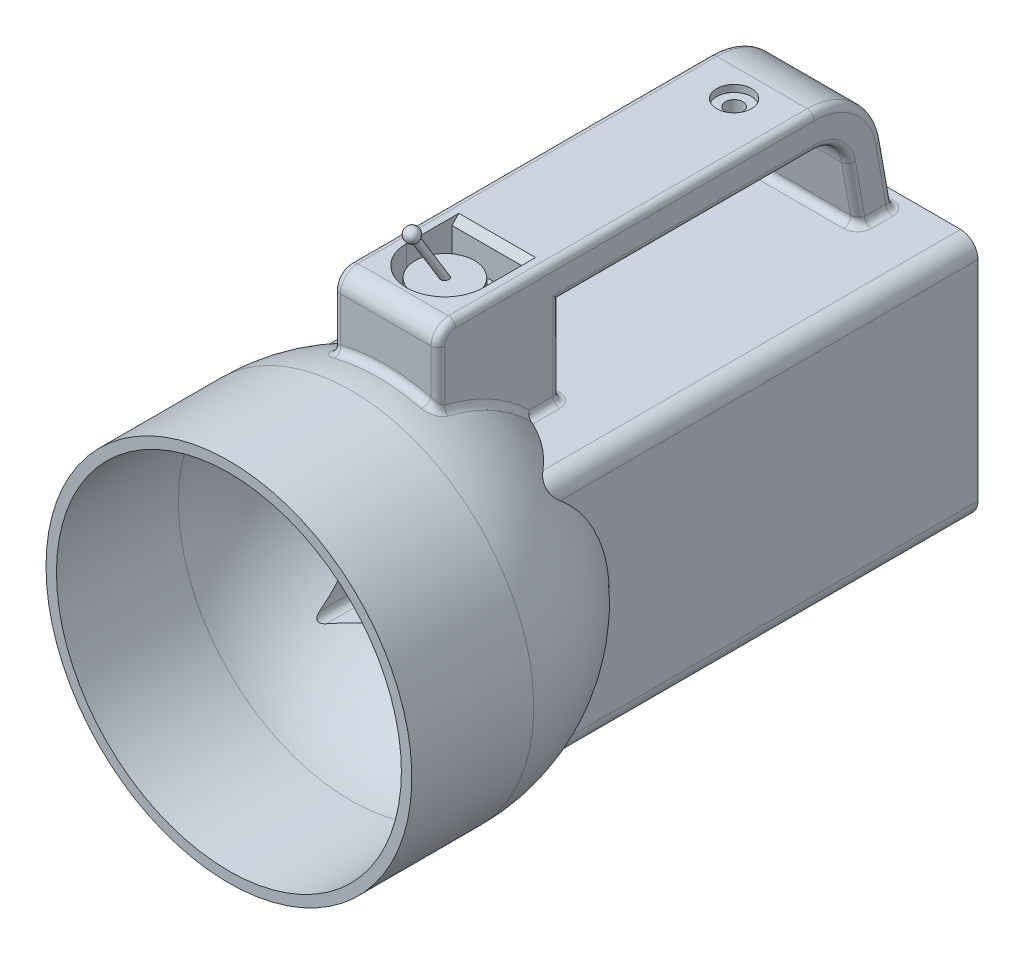
from build123d import *

# Parameters (mm, degrees)
SKETCH1_W                               = 70
SKETCH1_H                               = 70
BOSS_EXTRUDE2_DEPTH                     = 180
FILLET1_R                               = 5
SHELL1_START                            = 3
SHELL1_DEPTH                            = 177
SHELL1_START_2                          = 144.9999999
SHELL1_2_OUTLINE_R                      = 49.5
SHELL1_2_DEPTH                          = 35.0000001
BOSS_EXTRUDE3_DEPTH                     = 15
BOSS_EXTRUDE4_REACH                     = 220.661
SKETCH7_W                               = 30
SKETCH7_H                               = 35
CBORE_FOR_M5_HEX_HEAD_BOLT1_D           = 5
CBORE_FOR_M5_HEX_HEAD_BOLT1_DEPTH       = 10
CBORE_FOR_M5_HEX_HEAD_BOLT1_CBORE_D     = 10
CBORE_FOR_M5_HEX_HEAD_BOLT1_CBORE_DEPTH = 2
CUT_EXTRUDE1_DEPTH                      = 10
SKETCH14_R                              = 8.5
BOSS_EXTRUDE5_DEPTH                     = 7
FILLET2_R                               = 5
FILLET3_R                               = 2
CHAMFER1_SIZE                           = 2
RIB6_REACH                              = 190.577
SKETCH22_WALLS_W                        = 443.153814776
SKETCH22_WALLS_H                        = 3
RIB6_DRAFT_ANGLE                        = 10


with BuildPart() as part:
    # Sketch1 → Boss-Extrude2 (new body)
    with BuildSketch(Plane.XY):
        Rectangle(SKETCH1_W, SKETCH1_H)
    extrude(amount=BOSS_EXTRUDE2_DEPTH)

    # Sketch4 → Revolve3 (revolve)
    with BuildSketch(Plane(origin=(0, 0, 0), x_dir=(1, 0, 0), z_dir=(0, 1, 0))):
        with BuildLine():
            Line((-52.5, -145), (-52.5, -180))
            Line((-52.5, -180), (0, -180))
            Line((0, -180), (0, -92.5))
            ThreePointArc((0, -92.5), (-37.123106012, -107.876893988), (-52.5, -145))
        make_face()
    revolve(axis=Axis((0, 0, -34.561258659), (0, 0, 1)))

    # Fillet1
    fillet1_edges = [part.edges().sort_by_distance(p)[0] for p in [
        (-35, 35, 63.75),
        (35, 35, 63.75),
        (35, -35, 63.75),
        (-35, -35, 63.75),
    ]]
    fillet(fillet1_edges, radius=FILLET1_R)

    # Shell1: read off the stored shape, not the designer's step
    # Shell1 outline → Shell1 (cut)
    with BuildSketch(Plane.XY.offset(SHELL1_START)):
        with BuildLine():
            Line((-32, 30), (-32, -30))
            ThreePointArc((-32, -30), (-31.414213562, -31.414213562), (-30, -32))
            Line((-30, -32), (30, -32))
            ThreePointArc((30, -32), (31.414213562, -31.414213562), (32, -30))
            Line((32, -30), (32, 30))
            ThreePointArc((32, 30), (31.414213562, 31.414213562), (30, 32))
            Line((30, 32), (-30, 32))
            ThreePointArc((-30, 32), (-31.414213562, 31.414213562), (-32, 30))
        make_face()
    extrude(amount=SHELL1_DEPTH, mode=Mode.SUBTRACT)

    # Shell1 2 outline → Shell1 2 (cut)
    with BuildSketch(Plane.XY.offset(SHELL1_START_2)):
        Circle(SHELL1_2_OUTLINE_R)
        with BuildLine():
            ThreePointArc((-30, -32), (-31.414213562, -31.414213562), (-32, -30))
            Line((-32, -30), (-32, 30))
            ThreePointArc((-32, 30), (-31.414213562, 31.414213562), (-30, 32))
            Line((-30, 32), (30, 32))
            ThreePointArc((30, 32), (31.414213562, 31.414213562), (32, 30))
            Line((32, 30), (32, -30))
            ThreePointArc((32, -30), (31.414213562, -31.414213562), (30, -32))
            Line((30, -32), (-30, -32))
        make_face(mode=Mode.SUBTRACT)
    extrude(amount=SHELL1_2_DEPTH, mode=Mode.SUBTRACT)

    # Shell1 3 outline → Shell1 3 (revolve, cut)
    with BuildSketch(Plane.XZ):
        with BuildLine():
            Line((31.999999962, 145.00000005), (31.999999962, 107.234274766))
            ThreePointArc((31.999999962, 107.234274766), (44.912414765, 124.188344612), (49.5, 145.00000005))
            Line((49.5, 145.00000005), (31.999999962, 145.00000005))
        make_face()
    revolve(axis=Axis((0, 0, 0), (0, 0, 1)), mode=Mode.SUBTRACT)

    # Sketch6 → Boss-Extrude3 (add, symmetric)
    with BuildSketch(Plane(origin=(0, 0, 0), x_dir=(0, 0, -1), z_dir=(1, 0, 0))):
        with BuildLine():
            Line((-135, 70), (-135, 60))
            Line((-135, 60), (-100, 60))
            Line((-100, 60), (-27, 60))
            ThreePointArc((-27, 60), (-20.572123903, 57.660444431), (-17.15192247, 51.736481777))
            Line((-17.15192247, 51.736481777), (-14.200829171, 35))
            Line((-14.200829171, 35), (-4.046563052, 35))
            Line((-4.046563052, 35), (-7.30384494, 53.472963553))
            ThreePointArc((-7.30384494, 53.472963553), (-14.144247806, 65.320888862), (-27, 70))
            Line((-27, 70), (-100, 70))
            Line((-100, 70), (-135, 70))
        make_face()
    extrude(amount=BOSS_EXTRUDE3_DEPTH, both=True)

    # Sketch7 → Boss-Extrude4 (add, up to next)
    with BuildSketch(Plane.XZ.offset(-60), mode=Mode.PRIVATE) as boss_extrude4_sk1:
        with Locations((0, 117.5)):
            Rectangle(SKETCH7_W, SKETCH7_H)
    boss_extrude4_tool1 = extrude(boss_extrude4_sk1.sketch, amount=BOSS_EXTRUDE4_REACH, mode=Mode.PRIVATE) - part.part
    add(boss_extrude4_tool1.solids().sort_by_distance((0, 60, 117.5))[0])

    # CBORE for M5 Hex Head Bolt1
    with Locations(Plane(origin=(0, 70, 0), x_dir=(1, 0, 0), z_dir=(0, 1, 0))):
        with Locations((0, -35)):
            CounterBoreHole(CBORE_FOR_M5_HEX_HEAD_BOLT1_D / 2, CBORE_FOR_M5_HEX_HEAD_BOLT1_CBORE_D / 2, CBORE_FOR_M5_HEX_HEAD_BOLT1_CBORE_DEPTH, depth=CBORE_FOR_M5_HEX_HEAD_BOLT1_DEPTH)

    # Sketch13 → Cut-Extrude1 (cut)
    with BuildSketch(Plane(origin=(0, 70, 0), x_dir=(1, 0, 0), z_dir=(0, 1, 0))):
        with BuildLine():
            Line((-11, -105), (11, -105))
            Line((11, -105), (11, -118))
            ThreePointArc((11, -118), (0, -129), (-11, -118))
            Line((-11, -118), (-11, -105))
        make_face()
    extrude(amount=-CUT_EXTRUDE1_DEPTH, mode=Mode.SUBTRACT)

    # Sketch14 → Boss-Extrude5 (add)
    with BuildSketch(Plane(origin=(0, 60, 0), x_dir=(1, 0, 0), z_dir=(0, 1, 0))):
        with Locations(Location((0, -118, 0), (0, 0, 270))):
            Circle(SKETCH14_R)
    extrude(amount=BOSS_EXTRUDE5_DEPTH)

    # Fillet2
    fillet2_edges = [part.edges().sort_by_distance(p)[0] for p in [
        (0, 70, 135),
    ]]
    fillet(fillet2_edges, radius=FILLET2_R)

    # Fillet3
    fillet3_edges = [part.edges().sort_by_distance(p)[0] for p in [
        (-15, 35, 104.428959631),
        (0, 35, 100),
        (15, 35, 104.428959631),
        (-15, 47.5, 100),
        (0, 51.53882032, 135),
        (15, 44.13388125, 120.845279431),
        (15, 47.5, 100),
        (-15, 44.13388125, 120.845279431),
        (-15, 57.153853654, 135),
        (15, 57.153853654, 135),
        (-15, 68.535533906, 133.535533906),
        (15, 68.535533906, 133.535533906),
        (-15, 57.660444431, 20.572123903),
        (-15, 43.368240888, 15.67637582),
        (-15, 35, 9.123696111),
        (0, 35, 14.200829171),
        (-15, 44.236481777, 5.675203996),
        (0, 35, 4.046563052),
        (-15, 65.320888862, 14.144247806),
        (-15, 70, 78.5),
        (15, 70, 78.5),
        (15, 57.660444431, 20.572123903),
        (15, 43.368240888, 15.67637582),
        (15, 35, 9.123696111),
        (15, 44.236481777, 5.675203996),
        (15, 65.320888862, 14.144247806),
        (-15, 60, 63.5),
        (15, 60, 63.5),
    ]]
    fillet(fillet3_edges, radius=FILLET3_R)

    # Chamfer1
    chamfer1_edges = [part.edges().sort_by_distance(p)[0] for p in [
        (0, 70, 105),
    ]]
    chamfer(chamfer1_edges, length=CHAMFER1_SIZE)

    # Sketch18 → Revolve4 (revolve)
    with BuildSketch(Plane(origin=(51.095498823, 0, 29.5), x_dir=(0.5000000000000009, 0, -0.866025403784438), z_dir=(0.8660254037844382, 0, 0.500000000000001)), mode=Mode.PRIVATE) as revolve4_sk:
        with BuildLine():
            Line((-107.387150069, 78), (-101.036297108, 67))
            Line((-101.036297108, 67), (-102.190997647, 67))
            Line((-102.190997647, 67), (-110.119200877, 80.732050808))
            ThreePointArc((-110.119200877, 80.732050808), (-107.704987314, 80.414213562), (-107.387150069, 78))
        make_face()
    revolve(revolve4_sk.sketch.rotate(Axis((0, 67, 118), (-0.25000000000000266, 0.8660254037844358, 0.43301270189222363)), 26.565051177), axis=Axis((0, 67, 118), (-0.25000000000000266, 0.8660254037844358, 0.43301270189222363)))

    # Sketch22 walls → Rib6 (add, up to next)
    with BuildSketch(Plane.XY.offset(18), mode=Mode.PRIVATE) as rib6_sk1:
        with Locations((0, 17.5)):
            Rectangle(SKETCH22_WALLS_W, SKETCH22_WALLS_H)
    rib6_tool1 = extrude(rib6_sk1.sketch, amount=-RIB6_REACH, mode=Mode.PRIVATE) - part.part
    # Sketch22 walls → Rib6 (add, up to next)
    with BuildSketch(Plane.XY.offset(18), mode=Mode.PRIVATE) as rib6_sk2:
        with Locations((0, -17.5)):
            Rectangle(SKETCH22_WALLS_W, SKETCH22_WALLS_H)
    rib6_tool2 = extrude(rib6_sk2.sketch, amount=-RIB6_REACH, mode=Mode.PRIVATE) - part.part
    add(rib6_tool1.solids().sort_by_distance((0, 17.5, 18))[0])
    add(rib6_tool2.solids().sort_by_distance((0, -17.5, 18))[0])

    # Rib6 draft
    rib6_draft_faces = [part.faces().sort_by_distance(p)[0] for p in [
        (0, 19, 17.5),
        (0, 16, 17.5),
        (0, -16, 17.5),
        (0, -19, 17.5),
    ]]
    draft(rib6_draft_faces, Plane(origin=(0, 17.5, 18), x_dir=(1, 0, 0), z_dir=(0, 0, 1)), RIB6_DRAFT_ANGLE)


solid = part.part
